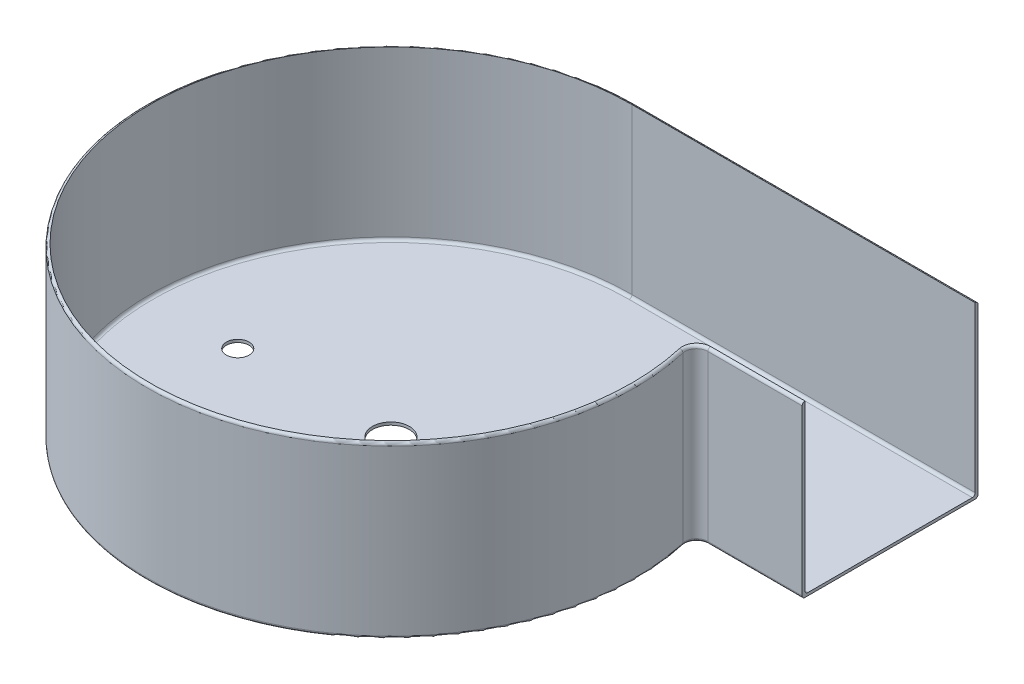
from build123d import *

# Parameters (mm, degrees)
BOSS_EXTRUDE1_DEPTH = 1
BOSS_EXTRUDE2_DEPTH = 60
SKETCH2_R           = 6.5
CUT_EXTRUDE1_DEPTH  = 1
FILLET1_R           = 1
SKETCH3_R           = 4
CUT_EXTRUDE2_DEPTH  = 1


with BuildPart() as part:
    # Sketch1 → Boss-Extrude1 (new body)
    with BuildSketch(Plane(origin=(0, 0, 0), x_dir=(1, 0, 0), z_dir=(0, 1, 0))):
        with BuildLine():
            Line((121, 24), (121, 86))
            Line((121, 86), (0, 86))
            ThreePointArc((0, 86), (-53.630422544, -67.229292557), (83.849659702, 19.111111111))
            ThreePointArc((83.849659702, 19.111111111), (84.622700034, 22.494438258), (87.749643874, 24))
            Line((87.749643874, 24), (121, 24))
        make_face()
    extrude(amount=BOSS_EXTRUDE1_DEPTH)

    # Sketch1<3> → Boss-Extrude2 (add)
    with BuildSketch(Plane(origin=(0, 0, 0), x_dir=(1, 0, 0), z_dir=(0, 1, 0))):
        with BuildLine():
            ThreePointArc((87.749643874, 24), (84.622700034, 22.494438258), (83.849659702, 19.111111111))
            ThreePointArc((83.849659702, 19.111111111), (-53.630422544, -67.229292557), (0, 86))
            Line((0, 86), (121, 86))
            Line((121, 86), (121, 85))
            Line((121, 85), (120, 85))
            Line((120, 85), (0, 85))
            ThreePointArc((0, 85), (-53.006812979, -66.447556597), (82.874663659, 18.888888889))
            ThreePointArc((82.874663659, 18.888888889), (83.840964074, 23.118047822), (87.749643874, 25))
            Line((87.749643874, 25), (120, 25))
            Line((120, 25), (121, 25))
            Line((121, 25), (121, 24))
            Line((121, 24), (87.749643874, 24))
        make_face()
    extrude(amount=BOSS_EXTRUDE2_DEPTH)

    # Sketch2 → Cut-Extrude1 (cut)
    with BuildSketch(Plane(origin=(0, 1, 0), x_dir=(1, 0, 0), z_dir=(0, 1, 0))):
        with Locations(Location((0, 0, 0), (0, 0, 270))):
            Circle(SKETCH2_R)
    extrude(amount=-CUT_EXTRUDE1_DEPTH, mode=Mode.SUBTRACT)

    # Fillet1
    fillet1_edges = [part.edges().sort_by_distance(p)[0] for p in [
        (104.374821937, 1, -25),
        (83.840964074, 1, -23.118047822),
        (60.5, 1, -85),
        (60.5, 0, -86),
        (104.374821937, 0, -24),
        (84.622700034, 0, -22.494438258),
        (60.5, 60, -86),
        (104.374821937, 60, -24),
        (84.622700034, 60, -22.494438258),
        (-53.006812979, 1, 66.447556597),
        (-53.630422544, 0, 67.229292557),
        (-53.630422544, 60, 67.229292557),
    ]]
    fillet(fillet1_edges, radius=FILLET1_R - 0.0001)  # a hair under: the kernel refuses the full size

    # Sketch3 → Cut-Extrude2 (cut)
    with BuildSketch(Plane.XZ):
        with Locations(Location((-54, 0, 0), (0, 0, 270))):
            Circle(SKETCH3_R)
        with Locations(Location((54, 0, 0), (0, 0, 270))):
            Circle(SKETCH3_R)
    extrude(amount=-CUT_EXTRUDE2_DEPTH, mode=Mode.SUBTRACT)


solid = part.part
